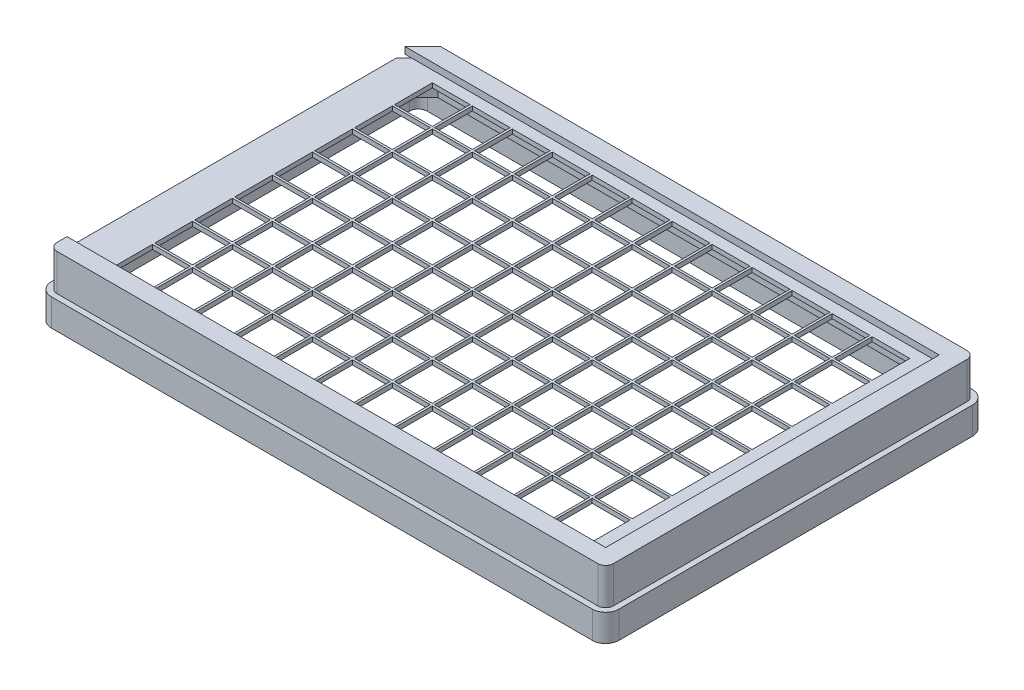
from build123d import *

# Parameters (mm, degrees)
SKETCH1_W           = 127.75
SKETCH1_H           = 85.6
BOSS_EXTRUDE1_DEPTH = 14.35
FILLET1_R           = 3
CUT_FLANGE_DEPTH    = 8.25
SKETCH5_W           = 80.1
SKETCH5_H           = 0.75
CUT_PAPERSLOT_DEPTH = 123.75
CUT_OPENTOP_REACH   = 80.216
SHELL1_DEPTH        = 11.1
SHELL1_2_DEPTH      = 5.1
SKETCH4_W           = 8.5
SKETCH4_H           = 8.5
CUT_EXTRUDE1_DEPTH  = 79.216226737


with BuildPart() as part:
    # Sketch1 → Boss-Extrude1 (new body)
    with BuildSketch(Plane(origin=(0, 0, 0), x_dir=(1, 0, 0), z_dir=(0, 1, 0))):
        Rectangle(SKETCH1_W, SKETCH1_H)
    extrude(amount=BOSS_EXTRUDE1_DEPTH)

    # Fillet1
    fillet1_edges = [part.edges().sort_by_distance(p)[0] for p in [
        (-63.875, 7.175, -42.8),
        (63.875, 7.175, -42.8),
        (63.875, 7.175, 42.8),
        (-63.875, 7.175, 42.8),
    ]]
    fillet(fillet1_edges, radius=FILLET1_R)

    # Sketch3 → Cut-Flange (cut)
    with BuildSketch(Plane(origin=(0, 14.35, 0), x_dir=(1, 0, 0), z_dir=(0, 1, 0))):
        with BuildLine():
            Line((-63.875, 39.8), (-63.875, -39.8))
            ThreePointArc((-63.875, -39.8), (-62.996320344, -41.921320344), (-60.875, -42.8))
            Line((-60.875, -42.8), (60.875, -42.8))
            ThreePointArc((60.875, -42.8), (62.996320344, -41.921320344), (63.875, -39.8))
            Line((63.875, -39.8), (63.875, 39.8))
            ThreePointArc((63.875, 39.8), (62.996320344, 41.921320344), (60.875, 42.8))
            Line((60.875, 42.8), (-60.875, 42.8))
            ThreePointArc((-60.875, 42.8), (-62.996320344, 41.921320344), (-63.875, 39.8))
        make_face()
        with BuildLine():
            Line((-62.625, 36.600252532), (-62.625, -39.8))
            ThreePointArc((-62.625, -39.8), (-62.112436867, -41.037436867), (-60.875, -41.55))
            Line((-60.875, -41.55), (60.875, -41.55))
            ThreePointArc((60.875, -41.55), (62.112436867, -41.037436867), (62.625, -39.8))
            Line((62.625, -39.8), (62.625, 39.8))
            ThreePointArc((62.625, 39.8), (62.112436867, 41.037436867), (60.875, 41.55))
            Line((60.875, 41.55), (-57.675252532, 41.55))
            Line((-57.675252532, 41.55), (-62.625, 36.600252532))
        make_face(mode=Mode.SUBTRACT)
    extrude(amount=-CUT_FLANGE_DEPTH, mode=Mode.SUBTRACT)

    # Sketch5 → Cut-PaperSlot (cut)
    with BuildSketch(Plane.ZY.offset(62.625)):
        with Locations((0, 12.475)):
            Rectangle(SKETCH5_W, SKETCH5_H)
    extrude(amount=-CUT_PAPERSLOT_DEPTH, mode=Mode.SUBTRACT)

    # Sketch6 → Cut-OpenTop (cut, up to next)
    with BuildSketch(Plane(origin=(0, 14.35, 0), x_dir=(1, 0, 0), z_dir=(0, 1, 0)), mode=Mode.PRIVATE) as cut_opentop_sk1:
        Polygon((-57.675252532, 37.55), (-61.675252532, 37.55), (-62.625, 36.600252532), (-62.625, -37.55), (-60.875, -37.55), (58.625, -37.55), (58.625, 37.55), align=None)
    cut_opentop_tool1 = extrude(cut_opentop_sk1.sketch, amount=-CUT_OPENTOP_REACH, mode=Mode.PRIVATE) & part.part
    add(cut_opentop_tool1.solids().sort_by_distance((-1.997013, 14.35, 0.001844))[0], mode=Mode.SUBTRACT)

    # Shell1: read off the stored shape, not the designer's step
    # Shell1 outline → Shell1 (cut)
    with BuildSketch(Plane(origin=(0, 0, 0), x_dir=(1, 0, 0), z_dir=(0, 1, 0))):
        with BuildLine():
            Line((-61.625, 36.186038969), (-61.625, -39.8))
            ThreePointArc((-61.625, -39.8), (-61.405330086, -40.330330086), (-60.875, -40.55))
            Line((-60.875, -40.55), (60.875, -40.55))
            ThreePointArc((60.875, -40.55), (61.405330086, -40.330330086), (61.625, -39.8))
            Line((61.625, -39.8), (61.625, 39.8))
            ThreePointArc((61.625, 39.8), (61.405330086, 40.330330086), (60.875, 40.55))
            Line((60.875, 40.55), (-57.261038969, 40.55))
            Line((-57.261038969, 40.55), (-61.625, 36.186038969))
        make_face()
    extrude(amount=SHELL1_DEPTH, mode=Mode.SUBTRACT)

    # Shell1 2 outline → Shell1 2 (cut)
    with BuildSketch(Plane(origin=(0, 0, 0), x_dir=(1, 0, 0), z_dir=(0, 1, 0))):
        with BuildLine():
            Line((-62.875, 39.8), (-62.875, -39.8))
            ThreePointArc((-62.875, -39.8), (-62.289213562, -41.214213562), (-60.875, -41.8))
            Line((-60.875, -41.8), (60.875, -41.8))
            ThreePointArc((60.875, -41.8), (62.289213562, -41.214213562), (62.875, -39.8))
            Line((62.875, -39.8), (62.875, 39.8))
            ThreePointArc((62.875, 39.8), (62.289213562, 41.214213562), (60.875, 41.8))
            Line((60.875, 41.8), (-60.875, 41.8))
            ThreePointArc((-60.875, 41.8), (-62.289213562, 41.214213562), (-62.875, 39.8))
        make_face()
        with BuildLine():
            ThreePointArc((-60.875, -40.55), (-61.405330086, -40.330330086), (-61.625, -39.8))
            Line((-61.625, -39.8), (-61.625, 36.186038969))
            Line((-61.625, 36.186038969), (-57.261038969, 40.55))
            Line((-57.261038969, 40.55), (60.875, 40.55))
            ThreePointArc((60.875, 40.55), (61.405330086, 40.330330086), (61.625, 39.8))
            Line((61.625, 39.8), (61.625, -39.8))
            ThreePointArc((61.625, -39.8), (61.405330086, -40.330330086), (60.875, -40.55))
            Line((60.875, -40.55), (-60.875, -40.55))
        make_face(mode=Mode.SUBTRACT)
    extrude(amount=SHELL1_2_DEPTH, mode=Mode.SUBTRACT)

    # Sketch4 → Cut-Extrude1 (cut, through all)
    with BuildSketch(Plane(origin=(0, 14.35, 0), x_dir=(1, 0, 0), z_dir=(0, 1, 0))):
        with Locations((-40.495, 31.56)):
            Rectangle(SKETCH4_W, SKETCH4_H)
        with Locations((-49.495, 31.56)):
            Rectangle(SKETCH4_W, SKETCH4_H)
        with Locations((-31.495, 31.56)):
            Rectangle(SKETCH4_W, SKETCH4_H)
        with Locations((-22.495, 31.56)):
            Rectangle(SKETCH4_W, SKETCH4_H)
        with Locations((-13.495, 31.56)):
            Rectangle(SKETCH4_W, SKETCH4_H)
        with Locations((-4.495, 31.56)):
            Rectangle(SKETCH4_W, SKETCH4_H)
        with Locations((4.505, 31.56)):
            Rectangle(SKETCH4_W, SKETCH4_H)
        with Locations((13.505, 31.56)):
            Rectangle(SKETCH4_W, SKETCH4_H)
        with Locations((22.505, 31.56)):
            Rectangle(SKETCH4_W, SKETCH4_H)
        with Locations((31.505, 31.56)):
            Rectangle(SKETCH4_W, SKETCH4_H)
        with Locations((40.505, 31.56)):
            Rectangle(SKETCH4_W, SKETCH4_H)
        with Locations((49.505, 31.56)):
            Rectangle(SKETCH4_W, SKETCH4_H)
        with Locations((-40.495, 22.56)):
            Rectangle(SKETCH4_W, SKETCH4_H)
        with Locations((-31.495, 22.56)):
            Rectangle(SKETCH4_W, SKETCH4_H)
        with Locations((-22.495, 22.56)):
            Rectangle(SKETCH4_W, SKETCH4_H)
        with Locations((-13.495, 22.56)):
            Rectangle(SKETCH4_W, SKETCH4_H)
        with Locations((-4.495, 22.56)):
            Rectangle(SKETCH4_W, SKETCH4_H)
        with Locations((4.505, 22.56)):
            Rectangle(SKETCH4_W, SKETCH4_H)
        with Locations((13.505, 22.56)):
            Rectangle(SKETCH4_W, SKETCH4_H)
        with Locations((22.505, 22.56)):
            Rectangle(SKETCH4_W, SKETCH4_H)
        with Locations((31.505, 22.56)):
            Rectangle(SKETCH4_W, SKETCH4_H)
        with Locations((40.505, 22.56)):
            Rectangle(SKETCH4_W, SKETCH4_H)
        with Locations((49.505, 22.56)):
            Rectangle(SKETCH4_W, SKETCH4_H)
        with Locations((-40.495, 13.56)):
            Rectangle(SKETCH4_W, SKETCH4_H)
        with Locations((-31.495, 13.56)):
            Rectangle(SKETCH4_W, SKETCH4_H)
        with Locations((-22.495, 13.56)):
            Rectangle(SKETCH4_W, SKETCH4_H)
        with Locations((-13.495, 13.56)):
            Rectangle(SKETCH4_W, SKETCH4_H)
        with Locations((-4.495, 13.56)):
            Rectangle(SKETCH4_W, SKETCH4_H)
        with Locations((4.505, 13.56)):
            Rectangle(SKETCH4_W, SKETCH4_H)
        with Locations((13.505, 13.56)):
            Rectangle(SKETCH4_W, SKETCH4_H)
        with Locations((22.505, 13.56)):
            Rectangle(SKETCH4_W, SKETCH4_H)
        with Locations((31.505, 13.56)):
            Rectangle(SKETCH4_W, SKETCH4_H)
        with Locations((40.505, 13.56)):
            Rectangle(SKETCH4_W, SKETCH4_H)
        with Locations((49.505, 13.56)):
            Rectangle(SKETCH4_W, SKETCH4_H)
        with Locations((-40.495, 4.56)):
            Rectangle(SKETCH4_W, SKETCH4_H)
        with Locations((-31.495, 4.56)):
            Rectangle(SKETCH4_W, SKETCH4_H)
        with Locations((-22.495, 4.56)):
            Rectangle(SKETCH4_W, SKETCH4_H)
        with Locations((-13.495, 4.56)):
            Rectangle(SKETCH4_W, SKETCH4_H)
        with Locations((-4.495, 4.56)):
            Rectangle(SKETCH4_W, SKETCH4_H)
        with Locations((4.505, 4.56)):
            Rectangle(SKETCH4_W, SKETCH4_H)
        with Locations((13.505, 4.56)):
            Rectangle(SKETCH4_W, SKETCH4_H)
        with Locations((22.505, 4.56)):
            Rectangle(SKETCH4_W, SKETCH4_H)
        with Locations((31.505, 4.56)):
            Rectangle(SKETCH4_W, SKETCH4_H)
        with Locations((40.505, 4.56)):
            Rectangle(SKETCH4_W, SKETCH4_H)
        with Locations((49.505, 4.56)):
            Rectangle(SKETCH4_W, SKETCH4_H)
        with Locations((-40.495, -4.44)):
            Rectangle(SKETCH4_W, SKETCH4_H)
        with Locations((-31.495, -4.44)):
            Rectangle(SKETCH4_W, SKETCH4_H)
        with Locations((-22.495, -4.44)):
            Rectangle(SKETCH4_W, SKETCH4_H)
        with Locations((-13.495, -4.44)):
            Rectangle(SKETCH4_W, SKETCH4_H)
        with Locations((-4.495, -4.44)):
            Rectangle(SKETCH4_W, SKETCH4_H)
        with Locations((4.505, -4.44)):
            Rectangle(SKETCH4_W, SKETCH4_H)
        with Locations((13.505, -4.44)):
            Rectangle(SKETCH4_W, SKETCH4_H)
        with Locations((22.505, -4.44)):
            Rectangle(SKETCH4_W, SKETCH4_H)
        with Locations((31.505, -4.44)):
            Rectangle(SKETCH4_W, SKETCH4_H)
        with Locations((40.505, -4.44)):
            Rectangle(SKETCH4_W, SKETCH4_H)
        with Locations((49.505, -4.44)):
            Rectangle(SKETCH4_W, SKETCH4_H)
        with Locations((-40.495, -13.44)):
            Rectangle(SKETCH4_W, SKETCH4_H)
        with Locations((-31.495, -13.44)):
            Rectangle(SKETCH4_W, SKETCH4_H)
        with Locations((-22.495, -13.44)):
            Rectangle(SKETCH4_W, SKETCH4_H)
        with Locations((-13.495, -13.44)):
            Rectangle(SKETCH4_W, SKETCH4_H)
        with Locations((-4.495, -13.44)):
            Rectangle(SKETCH4_W, SKETCH4_H)
        with Locations((4.505, -13.44)):
            Rectangle(SKETCH4_W, SKETCH4_H)
        with Locations((13.505, -13.44)):
            Rectangle(SKETCH4_W, SKETCH4_H)
        with Locations((22.505, -13.44)):
            Rectangle(SKETCH4_W, SKETCH4_H)
        with Locations((31.505, -13.44)):
            Rectangle(SKETCH4_W, SKETCH4_H)
        with Locations((40.505, -13.44)):
            Rectangle(SKETCH4_W, SKETCH4_H)
        with Locations((49.505, -13.44)):
            Rectangle(SKETCH4_W, SKETCH4_H)
        with Locations((-40.495, -22.44)):
            Rectangle(SKETCH4_W, SKETCH4_H)
        with Locations((-31.495, -22.44)):
            Rectangle(SKETCH4_W, SKETCH4_H)
        with Locations((-22.495, -22.44)):
            Rectangle(SKETCH4_W, SKETCH4_H)
        with Locations((-13.495, -22.44)):
            Rectangle(SKETCH4_W, SKETCH4_H)
        with Locations((-4.495, -22.44)):
            Rectangle(SKETCH4_W, SKETCH4_H)
        with Locations((4.505, -22.44)):
            Rectangle(SKETCH4_W, SKETCH4_H)
        with Locations((13.505, -22.44)):
            Rectangle(SKETCH4_W, SKETCH4_H)
        with Locations((22.505, -22.44)):
            Rectangle(SKETCH4_W, SKETCH4_H)
        with Locations((31.505, -22.44)):
            Rectangle(SKETCH4_W, SKETCH4_H)
        with Locations((40.505, -22.44)):
            Rectangle(SKETCH4_W, SKETCH4_H)
        with Locations((49.505, -22.44)):
            Rectangle(SKETCH4_W, SKETCH4_H)
        with Locations((-40.495, -31.44)):
            Rectangle(SKETCH4_W, SKETCH4_H)
        with Locations((-31.495, -31.44)):
            Rectangle(SKETCH4_W, SKETCH4_H)
        with Locations((-22.495, -31.44)):
            Rectangle(SKETCH4_W, SKETCH4_H)
        with Locations((-13.495, -31.44)):
            Rectangle(SKETCH4_W, SKETCH4_H)
        with Locations((-4.495, -31.44)):
            Rectangle(SKETCH4_W, SKETCH4_H)
        with Locations((4.505, -31.44)):
            Rectangle(SKETCH4_W, SKETCH4_H)
        with Locations((13.505, -31.44)):
            Rectangle(SKETCH4_W, SKETCH4_H)
        with Locations((22.505, -31.44)):
            Rectangle(SKETCH4_W, SKETCH4_H)
        with Locations((31.505, -31.44)):
            Rectangle(SKETCH4_W, SKETCH4_H)
        with Locations((40.505, -31.44)):
            Rectangle(SKETCH4_W, SKETCH4_H)
        with Locations((49.505, -31.44)):
            Rectangle(SKETCH4_W, SKETCH4_H)
        with Locations((-49.495, 22.56)):
            Rectangle(SKETCH4_W, SKETCH4_H)
        with Locations((-49.495, 13.56)):
            Rectangle(SKETCH4_W, SKETCH4_H)
        with Locations((-49.495, 4.56)):
            Rectangle(SKETCH4_W, SKETCH4_H)
        with Locations((-49.495, -4.44)):
            Rectangle(SKETCH4_W, SKETCH4_H)
        with Locations((-49.495, -13.44)):
            Rectangle(SKETCH4_W, SKETCH4_H)
        with Locations((-49.495, -22.44)):
            Rectangle(SKETCH4_W, SKETCH4_H)
        with Locations((-49.495, -31.44)):
            Rectangle(SKETCH4_W, SKETCH4_H)
    extrude(amount=-CUT_EXTRUDE1_DEPTH, mode=Mode.SUBTRACT)


solid = part.part
